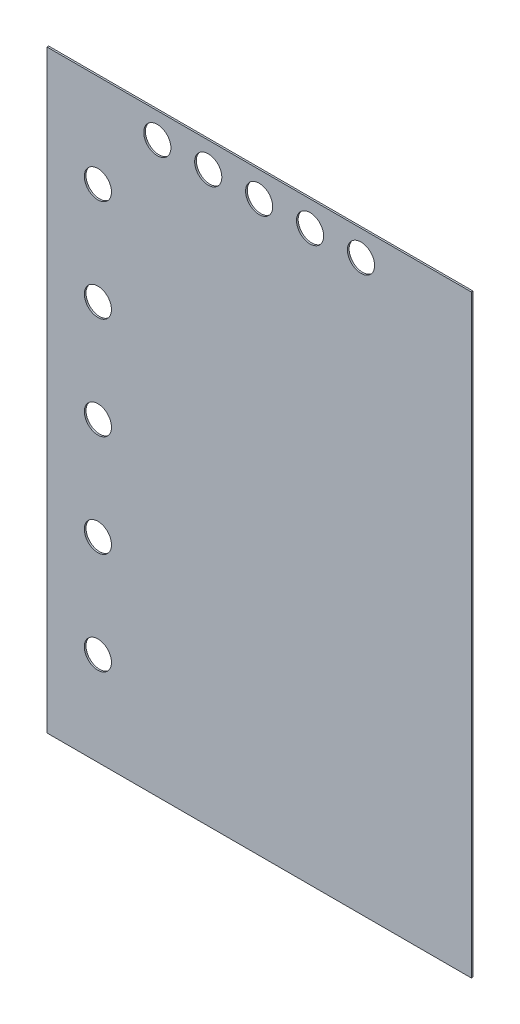
from build123d import *

# Parameters (mm, degrees)
SKETCH1_W           = 350
SKETCH1_H           = 250
BOSS_EXTRUDE1_DEPTH = 1
SKETCH2_R           = 8
CUT_EXTRUDE1_DEPTH  = 216.060456616
SKETCH3_R           = 8
CUT_EXTRUDE2_DEPTH  = 216.060456616


with BuildPart() as part:
    # Sketch1 → Boss-Extrude1 (new body)
    with BuildSketch(Plane(origin=(0, 0, 0), x_dir=(0, 1, 0), z_dir=(0, 0, 1))):
        Rectangle(SKETCH1_W, SKETCH1_H)
    extrude(amount=BOSS_EXTRUDE1_DEPTH)

    # Sketch2 → Cut-Extrude1 (cut, through all)
    with BuildSketch(Plane(origin=(0, 0, 1), x_dir=(0, -1, 0), z_dir=(0, 0, 1))):
        with Locations((-160, -60)):
            Circle(SKETCH2_R)
        with Locations((-160, -30)):
            Circle(SKETCH2_R)
        with Locations((-160, 0)):
            Circle(SKETCH2_R)
        with Locations((-160, 30)):
            Circle(SKETCH2_R)
        with Locations((-160, 60)):
            Circle(SKETCH2_R)
    extrude(amount=-CUT_EXTRUDE1_DEPTH, mode=Mode.SUBTRACT)

    # Sketch3 → Cut-Extrude2 (cut, through all)
    with BuildSketch(Plane(origin=(0, 0, 1), x_dir=(0, -1, 0), z_dir=(0, 0, 1))):
        with Locations((120, -95)):
            Circle(SKETCH3_R)
        with Locations((60, -95)):
            Circle(SKETCH3_R)
        with Locations((0, -95)):
            Circle(SKETCH3_R)
        with Locations((-60, -95)):
            Circle(SKETCH3_R)
        with Locations((-120, -95)):
            Circle(SKETCH3_R)
    extrude(amount=-CUT_EXTRUDE2_DEPTH, mode=Mode.SUBTRACT)


solid = part.part
